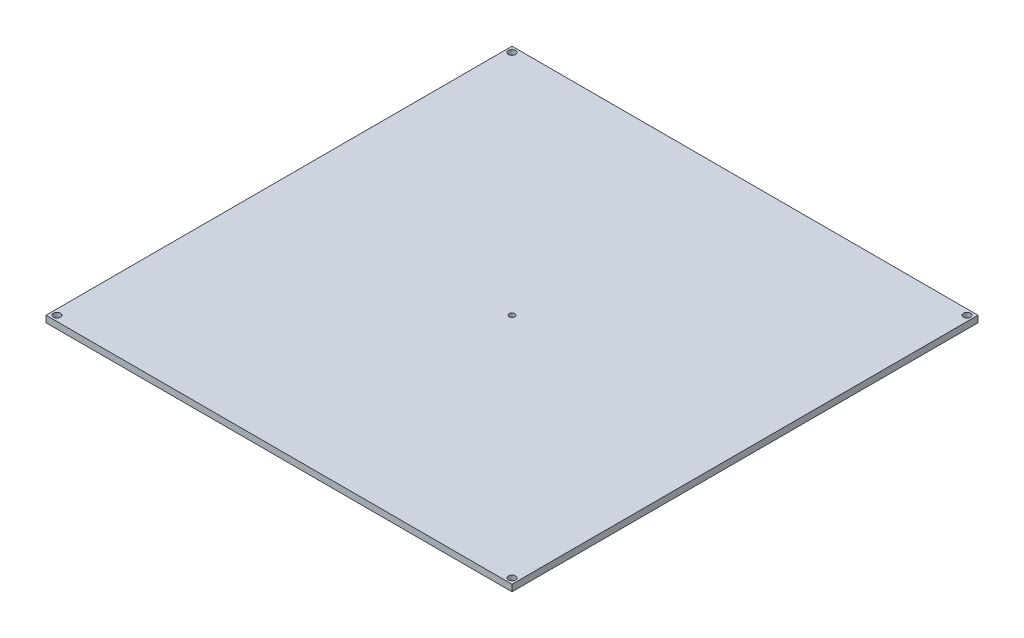
from build123d import *

# Parameters (mm, degrees)
SKETCH1_W                       = 213.5
SKETCH1_H                       = 213.5
BASE_FLANGE1_DEPTH              = 3
F_3_0MM_CLEARANCE_DOWEL_HOLE1_D = 3.2
F_2_5MM_CLEARANCE_DOWEL_HOLE1_D = 2.5


# Sheet-metal steps are written as plain solids
with BuildPart() as part:
    # Sketch1 → Base-Flange1 (new body)
    with BuildSketch(Plane(origin=(0, 0, 0), x_dir=(1, 0, 0), z_dir=(0, 1, 0))):
        Rectangle(SKETCH1_W, SKETCH1_H)
    extrude(amount=-BASE_FLANGE1_DEPTH)

    # Ø3.0mm Clearance Dowel Hole1 (through all)
    with Locations(Plane(origin=(0, 0, 0), x_dir=(1, 0, 0), z_dir=(0, 1, 0))):
        with Locations((-104.25, 104.25), (-104.25, -104.25)):
            f_3_0mm_clearance_dowel_hole1 = Hole(F_3_0MM_CLEARANCE_DOWEL_HOLE1_D / 2)

    # Mirror2: Ø3.0mm Clearance Dowel Hole1 across plane
    add(f_3_0mm_clearance_dowel_hole1.mirror(Plane(origin=(0, 0, 0), x_dir=(0, 0, 1), z_dir=(1, 0, 0))), mode=Mode.SUBTRACT)

    # Ø2.5mm Clearance Dowel Hole1 (through all)
    with Locations(Plane(origin=(0, 0, 0), x_dir=(1, 0, 0), z_dir=(0, 1, 0))):
        with Locations((0, 0)):
            Hole(F_2_5MM_CLEARANCE_DOWEL_HOLE1_D / 2)


solid = part.part
